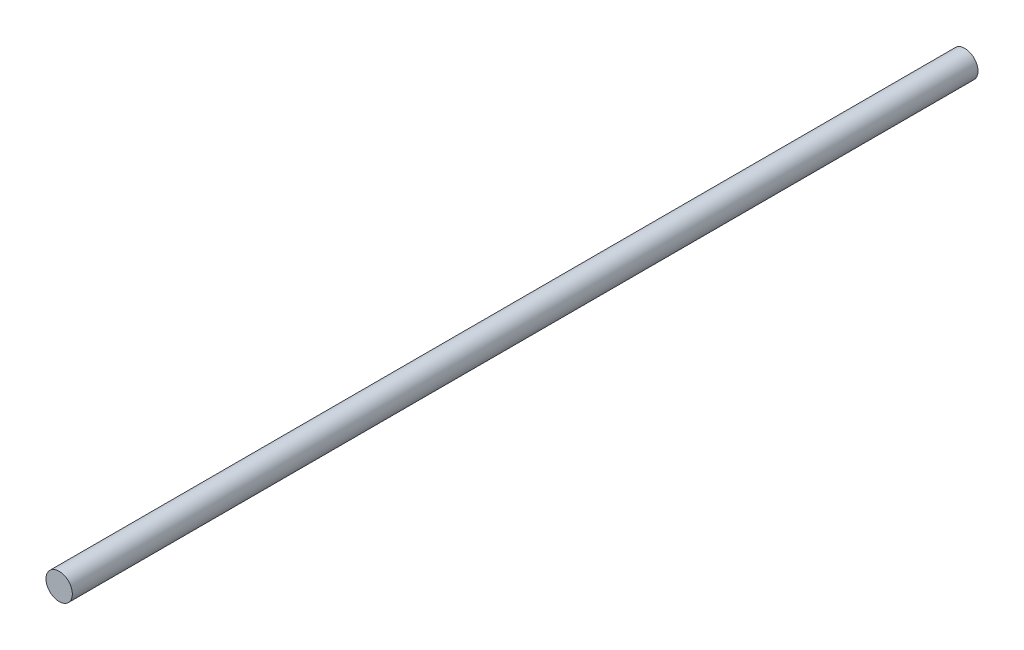
from build123d import *

# Parameters (mm, degrees)
BOSS_EXTRUDE1_DEPTH      = 137.5
BOSS_EXTRUDE1_DEPTH_BACK = 137.5
SKETCH1_R                = 4


with BuildPart() as part:
    # Sketch1 → Boss-Extrude1 (new, two sides: drawn at the far end of the back side and taken through both)
    with BuildSketch(Plane.XY.offset(-BOSS_EXTRUDE1_DEPTH_BACK)):
        Circle(SKETCH1_R)
    extrude(amount=BOSS_EXTRUDE1_DEPTH + BOSS_EXTRUDE1_DEPTH_BACK)


solid = part.part
